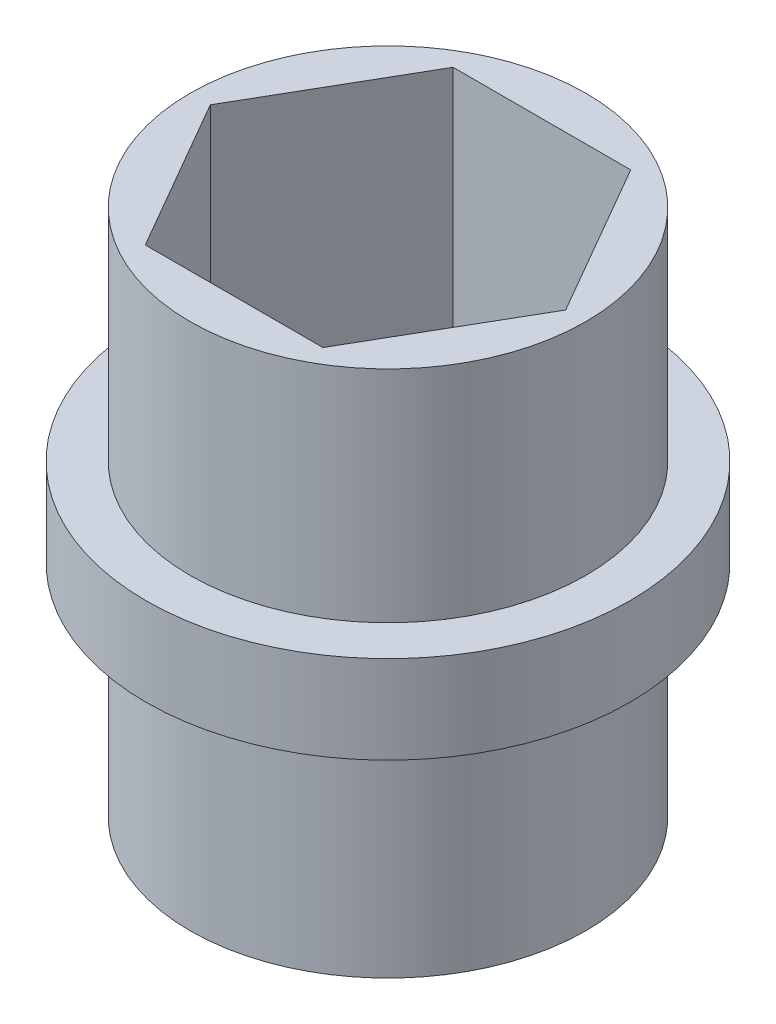
from build123d import *

# Parameters (mm, degrees)
SKETCH2_R           = 4.5
BOSS_EXTRUDE1_DEPTH = 12
SKETCH3_R           = 5.5
SKETCH3_R_2         = 4.5
BOSS_EXTRUDE2_DEPTH = 1


with BuildPart() as part:
    # Sketch2 → Boss-Extrude1 (new body)
    with BuildSketch(Plane(origin=(0, 0, 0), x_dir=(1, 0, 0), z_dir=(0, 1, 0))):
        Circle(SKETCH2_R)
        Polygon((4.041451884, 0), (2.020725942, 3.5), (-2.020725942, 3.5), (-4.041451884, 0), (-2.020725942, -3.5), (2.020725942, -3.5), align=None, mode=Mode.SUBTRACT)
    extrude(amount=BOSS_EXTRUDE1_DEPTH)

    # Sketch3 → Boss-Extrude2 (add, symmetric)
    with BuildSketch(Plane(origin=(0, 6, 0), x_dir=(-1, 0, 0), z_dir=(0, -1, 0))):
        Circle(SKETCH3_R)
        Circle(SKETCH3_R_2, mode=Mode.SUBTRACT)
    extrude(amount=BOSS_EXTRUDE2_DEPTH, both=True)


solid = part.part
